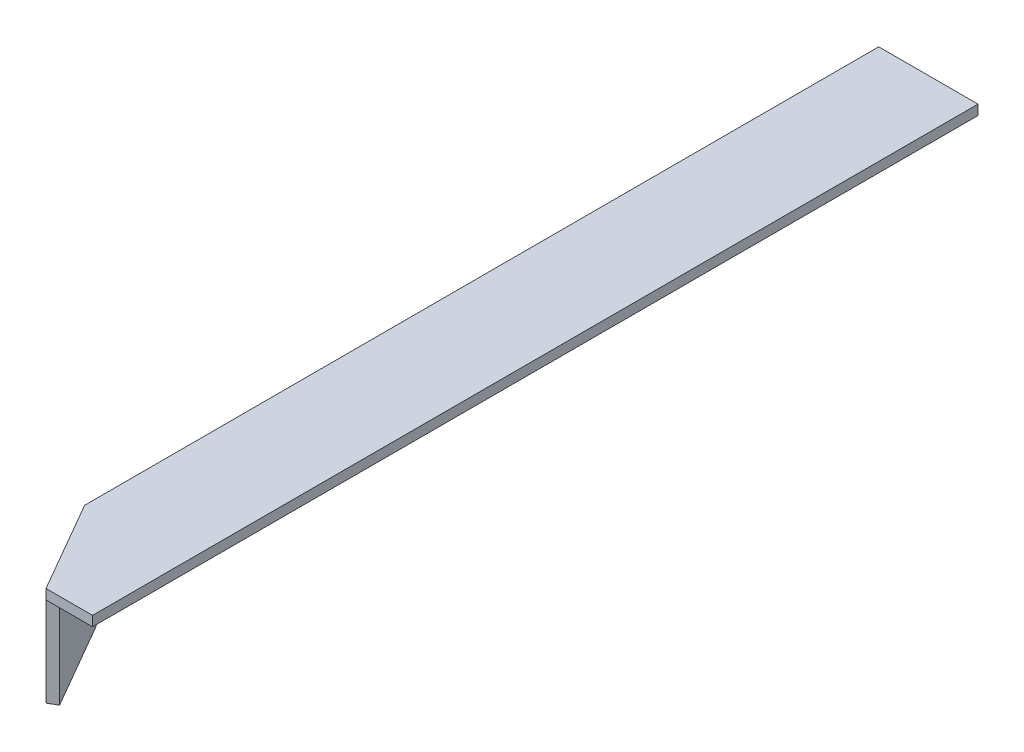
from build123d import *

# Parameters (mm, degrees)
BOSS_EXTRUDE1_DEPTH = 640
BOSS_EXTRUDE2_DEPTH = 8
BOSS_EXTRUDE3_DEPTH = 72


with BuildPart() as part:
    # Sketch1 → Boss-Extrude1 (new body)
    with BuildSketch(Plane.XY):
        Polygon((-8, 8), (72, 8), (72, 0), (0, 0), (0, -72), (-8, -72), align=None)
    extrude(amount=BOSS_EXTRUDE1_DEPTH)

    # Sketch3 → Boss-Extrude2 (add)
    with BuildSketch(Plane(origin=(0, 0, 0), x_dir=(1, 0, 0), z_dir=(0, 1, 0))):
        Polygon((-8, -640), (34.5, -713.612159322), (72, -713.612159322), (72, -640), align=None)
    extrude(amount=BOSS_EXTRUDE2_DEPTH)

    # Sketch4 → Boss-Extrude3 (add)
    with BuildSketch(Plane.XZ):
        Polygon((-8, 640), (34.5, 713.612159322), (41.42820323, 709.612159322), (1.237604307, 640), align=None)
    extrude(amount=BOSS_EXTRUDE3_DEPTH)


solid = part.part
